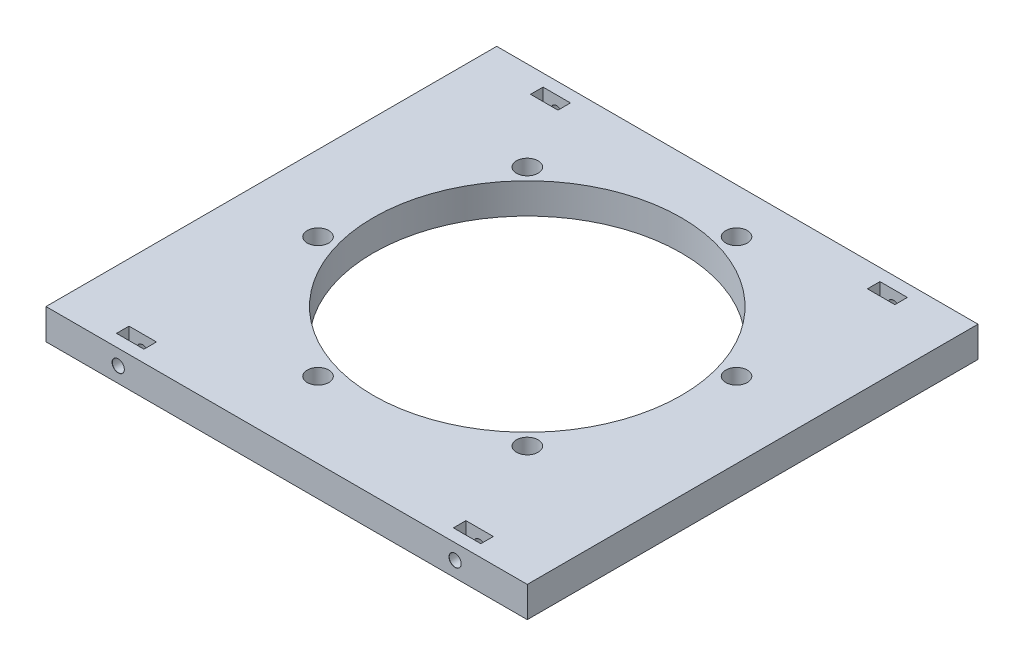
from build123d import *

# Parameters (mm, degrees)
SKETCH1_W                             = 100
SKETCH1_H                             = 100
SKETCH1_R                             = 32
BOSS_EXTRUDE3_DEPTH                   = 6.35
M4_CLEARANCE_HOLE2_D                  = 4.5
M4_CLEARANCE_HOLE2_CSINK_D            = 4.55
M4_CLEARANCE_HOLE2_CSINK_ANGLE        = 90
TAP_DRILL_FOR_M3X0_5_TAP2_D           = 2.5
TAP_DRILL_FOR_M3X0_5_TAP2_DEPTH       = 9.248924226
TAP_DRILL_FOR_M3X0_5_TAP2_CSINK_D     = 2.55
TAP_DRILL_FOR_M3X0_5_TAP2_CSINK_ANGLE = 90
TAP_DRILL_FOR_M3X0_5_TAP2_TIP         = 0.751075774
SKETCH32_W                            = 100
SKETCH32_H                            = 6.35
CUT_EXTRUDE1_DEPTH                    = 10
TAP_DRILL_FOR_M3X0_5_TAP4_D           = 2.5
TAP_DRILL_FOR_M3X0_5_TAP4_DEPTH       = 9.248924226
TAP_DRILL_FOR_M3X0_5_TAP4_CSINK_D     = 2.55
TAP_DRILL_FOR_M3X0_5_TAP4_CSINK_ANGLE = 90
TAP_DRILL_FOR_M3X0_5_TAP4_TIP         = 0.751075774
SKETCH36_W                            = 5.7
SKETCH36_H                            = 2.6
CUT_EXTRUDE2_DEPTH                    = 71.995228713


with BuildPart() as part:
    # Sketch1 → Boss-Extrude3 (new body)
    with BuildSketch(Plane(origin=(0, 0, 0), x_dir=(1, 0, 0), z_dir=(0, 1, 0))):
        Rectangle(SKETCH1_W, SKETCH1_H)
        Circle(SKETCH1_R, mode=Mode.SUBTRACT)
    extrude(amount=BOSS_EXTRUDE3_DEPTH)

    # M4 Clearance Hole2 (through all)
    with Locations(Plane(origin=(0, 0, 0), x_dir=(-1, 0, 0), z_dir=(0, -1, 0))):
        with Locations((-9.188076101, 34.290366833), (25.102290732, 25.102290732), (34.290366833, -9.188076101), (9.188076101, -34.290366833), (-25.102290732, -25.102290732), (-34.290366833, 9.188076101)):
            CounterSinkHole(M4_CLEARANCE_HOLE2_D / 2, M4_CLEARANCE_HOLE2_CSINK_D / 2, counter_sink_angle=M4_CLEARANCE_HOLE2_CSINK_ANGLE)

    # Tap Drill for M3x0.5 Tap2
    with Locations(Plane.XY.offset(50)):
        with Locations((-35, 3.175), (35, 3.175)):
            CounterSinkHole(TAP_DRILL_FOR_M3X0_5_TAP2_D / 2, TAP_DRILL_FOR_M3X0_5_TAP2_CSINK_D / 2, depth=TAP_DRILL_FOR_M3X0_5_TAP2_DEPTH, counter_sink_angle=TAP_DRILL_FOR_M3X0_5_TAP2_CSINK_ANGLE)
            with Locations((0, 0, -(TAP_DRILL_FOR_M3X0_5_TAP2_DEPTH + TAP_DRILL_FOR_M3X0_5_TAP2_TIP / 2))):  # 118° drill point
                Cone(0, TAP_DRILL_FOR_M3X0_5_TAP2_D / 2, TAP_DRILL_FOR_M3X0_5_TAP2_TIP, mode=Mode.SUBTRACT)

    # Sketch32 → Cut-Extrude1 (cut)
    with BuildSketch(Plane(origin=(0, 6.35, 0), x_dir=(1, 0, 0), z_dir=(0, 1, 0))):
        with Locations((0, 46.825)):
            Rectangle(SKETCH32_W, SKETCH32_H)
    extrude(amount=-CUT_EXTRUDE1_DEPTH, mode=Mode.SUBTRACT)

    # Tap Drill for M3x0.5 Tap4
    with Locations(Plane(origin=(0, 0, -43.65), x_dir=(-1, 0, 0), z_dir=(0, 0, -1))):
        with Locations((-35, 3.175), (35, 3.175)):
            CounterSinkHole(TAP_DRILL_FOR_M3X0_5_TAP4_D / 2, TAP_DRILL_FOR_M3X0_5_TAP4_CSINK_D / 2, depth=TAP_DRILL_FOR_M3X0_5_TAP4_DEPTH, counter_sink_angle=TAP_DRILL_FOR_M3X0_5_TAP4_CSINK_ANGLE)
            with Locations((0, 0, -(TAP_DRILL_FOR_M3X0_5_TAP4_DEPTH + TAP_DRILL_FOR_M3X0_5_TAP4_TIP / 2))):  # 118° drill point
                Cone(0, TAP_DRILL_FOR_M3X0_5_TAP4_D / 2, TAP_DRILL_FOR_M3X0_5_TAP4_TIP, mode=Mode.SUBTRACT)

    # Sketch36 → Cut-Extrude2 (cut, through all)
    with BuildSketch(Plane(origin=(0, 6.35, 0), x_dir=(1, 0, 0), z_dir=(0, 1, 0))):
        with Locations((-35, -46.2)):
            Rectangle(SKETCH36_W, SKETCH36_H)
        with Locations((35, -46.2)):
            Rectangle(SKETCH36_W, SKETCH36_H)
        with Locations((35, 39.825)):
            Rectangle(SKETCH36_W, SKETCH36_H)
        with Locations((-35, 39.825)):
            Rectangle(SKETCH36_W, SKETCH36_H)
    extrude(amount=-CUT_EXTRUDE2_DEPTH, mode=Mode.SUBTRACT)


solid = part.part
